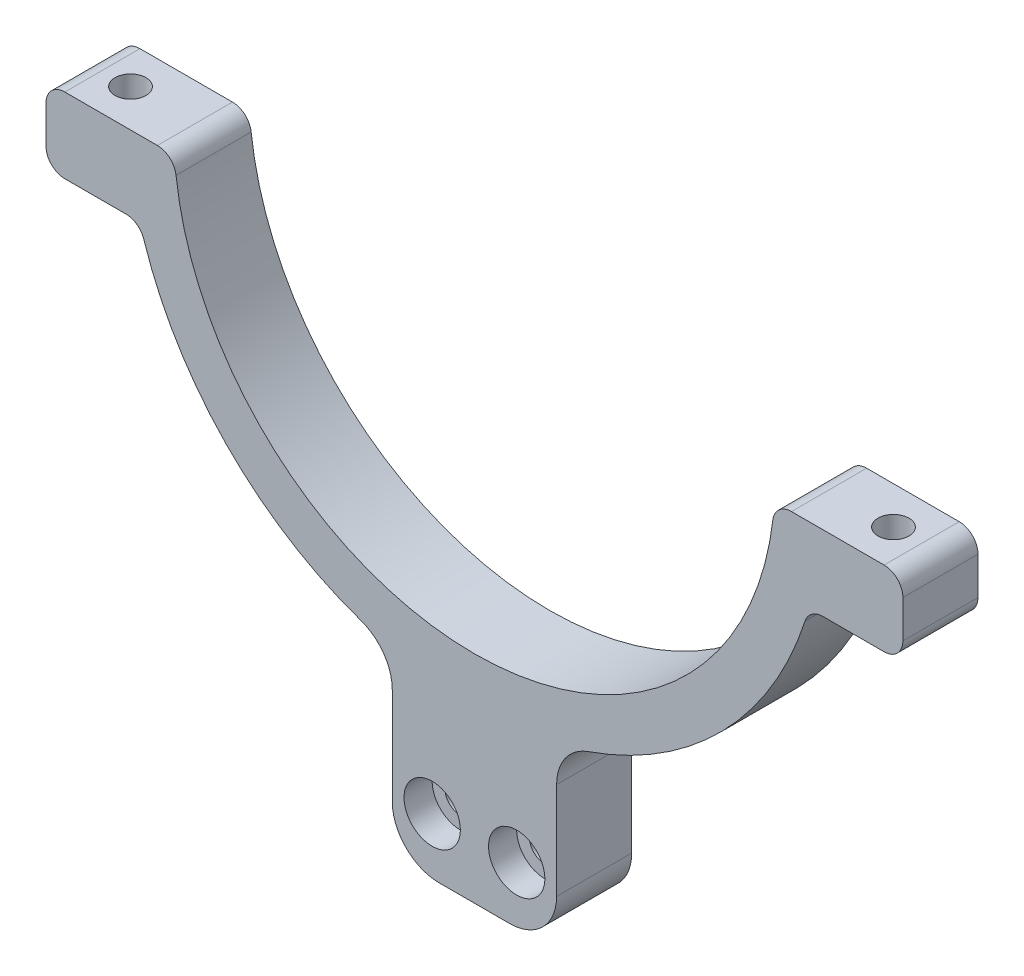
from build123d import *

# Parameters (mm, degrees)
SKETCH3_R           = 8.05
BOSS_EXTRUDE1_DEPTH = 8
SKETCH4_R           = 8.05
SKETCH4_R_2         = 4.3
BOSS_EXTRUDE2_DEPTH = 3
CHAMFER1_SIZE       = 3
FILLET1_R           = 11
SKETCH5_R           = 1.65
CUT_EXTRUDE1_DEPTH  = 85.020655349
SKETCH6_R           = 3
CUT_EXTRUDE2_DEPTH  = 3
SKETCH7_W           = 22
SKETCH7_H           = 25.1
CUT_EXTRUDE3_DEPTH  = 93.528214752
FILLET2_R           = 2
SKETCH8_R           = 1.65
CUT_EXTRUDE4_DEPTH  = 72.905914397
CUT_EXTRUDE5_DEPTH  = 72.905914397
FILLET3_R           = 5
SKETCH10_R          = 3
CUT_EXTRUDE6_DEPTH  = 3


with BuildPart() as part:
    # Sketch3 → Boss-Extrude1 (new body)
    with BuildSketch(Plane.XY):
        with BuildLine():
            Line((-31.937438845, -2), (-45.623026261, -2))
            Line((-45.623026261, -2), (-45.623026261, -10))
            Line((-45.623026261, -10), (-35.623026261, -10))
            ThreePointArc((-35.623026261, -10), (-26.529067588, -25.791637654), (-11, -35.327043465))
            Line((-11, -35.327043465), (-11, -80.1))
            Line((-11, -80.1), (11, -80.1))
            Line((11, -80.1), (11, -35.327043465))
            ThreePointArc((11, -35.327043465), (26.529067588, -25.791637654), (35.623026261, -10))
            Line((35.623026261, -10), (45.623026261, -10))
            Line((45.623026261, -10), (45.623026261, -2))
            Line((45.623026261, -2), (31.937438845, -2))
            ThreePointArc((31.937438845, -2), (0, -32), (-31.937438845, -2))
        make_face()
        with Locations((0, -69.1)):
            Circle(SKETCH3_R, mode=Mode.SUBTRACT)
    extrude(amount=BOSS_EXTRUDE1_DEPTH)

    # Sketch4 → Boss-Extrude2 (add)
    with BuildSketch(Plane.XY):
        with Locations(Location((0, -69.1, 0), (0, 0, 180))):
            Circle(SKETCH4_R)
        with Locations(Location((0, -69.1, 0), (0, 0, 180))):
            Circle(SKETCH4_R_2, mode=Mode.SUBTRACT)
    extrude(amount=BOSS_EXTRUDE2_DEPTH)

    # Chamfer1
    chamfer1_edges = [part.edges().sort_by_distance(p)[0] for p in [
        (0, -80.1, 0),
    ]]
    chamfer(chamfer1_edges, length=CHAMFER1_SIZE)

    # Fillet1
    fillet1_edges = [part.edges().sort_by_distance(p)[0] for p in [
        (-11, -80.1, 5.5),
        (11, -80.1, 5.5),
    ]]
    fillet(fillet1_edges, radius=FILLET1_R - 0.0001)  # a hair under: the kernel refuses the full size

    # Sketch5 → Cut-Extrude1 (cut, through all)
    with BuildSketch(Plane.XZ.offset(10)):
        with Locations((40.623026261, 4)):
            Circle(SKETCH5_R)
    cut_extrude1 = extrude(amount=-CUT_EXTRUDE1_DEPTH, mode=Mode.SUBTRACT)

    # Sketch6 → Cut-Extrude2 (cut)
    with BuildSketch(Plane.XZ.offset(10)):
        with Locations((40.623026261, 4)):
            Circle(SKETCH6_R)
    cut_extrude2 = extrude(amount=-CUT_EXTRUDE2_DEPTH, mode=Mode.SUBTRACT)

    # Mirror1: Cut-Extrude1, Cut-Extrude2 across plane
    add(cut_extrude1.mirror(Plane(origin=(0, 0, 0), x_dir=(0, 0, 1), z_dir=(1, 0, 0))), mode=Mode.SUBTRACT)
    add(cut_extrude2.mirror(Plane(origin=(0, 0, 0), x_dir=(0, 0, 1), z_dir=(1, 0, 0))), mode=Mode.SUBTRACT)

    # Sketch7 → Cut-Extrude3 (cut, through all)
    with BuildSketch(Plane.XY.offset(8)):
        with Locations((0, -67.55)):
            Rectangle(SKETCH7_W, SKETCH7_H)
    extrude(amount=-CUT_EXTRUDE3_DEPTH, mode=Mode.SUBTRACT)

    # Fillet2
    fillet2_edges = [part.edges().sort_by_distance(p)[0] for p in [
        (-45.623026261, -2, 4),
        (-31.937438845, -2, 4),
        (31.937438845, -2, 4),
        (45.623026261, -2, 4),
        (45.623026261, -10, 4),
        (35.623026261, -10, 4),
        (-35.623026261, -10, 4),
        (-45.623026261, -10, 4),
    ]]
    fillet(fillet2_edges, radius=FILLET2_R - 0.0001)  # a hair under: the kernel refuses the full size

    # Sketch8 → Cut-Extrude4 (cut, through all)
    with BuildSketch(Plane.XY.offset(8)):
        with Locations((4.5, -49)):
            Circle(SKETCH8_R)
        with Locations((-4.5, -49)):
            Circle(SKETCH8_R)
    extrude(amount=-CUT_EXTRUDE4_DEPTH, mode=Mode.SUBTRACT)

    # Sketch9 → Cut-Extrude5 (cut, through all)
    with BuildSketch(Plane.XY.offset(8)):
        with BuildLine():
            Line((-8.75, -55), (-8.75, -35.950486784))
            ThreePointArc((-8.75, -35.950486784), (-9.879918795, -35.656517001), (-11, -35.327043465))
            Line((-11, -35.327043465), (-11, -55))
            Line((-11, -55), (-8.75, -55))
        make_face()
        with BuildLine():
            Line((8.75, -55), (8.75, -35.950486784))
            ThreePointArc((8.75, -35.950486784), (9.879918795, -35.656517001), (11, -35.327043465))
            Line((11, -35.327043465), (11, -55))
            Line((11, -55), (8.75, -55))
        make_face()
    extrude(amount=-CUT_EXTRUDE5_DEPTH, mode=Mode.SUBTRACT)

    # Fillet3
    fillet3_edges = [part.edges().sort_by_distance(p)[0] for p in [
        (-8.75, -55, 4),
        (-8.75, -35.950486784, 4),
        (8.75, -55, 4),
        (8.75, -35.950486784, 4),
    ]]
    fillet(fillet3_edges, radius=FILLET3_R)

    # Sketch10 → Cut-Extrude6 (cut)
    with BuildSketch(Plane.XY.offset(8)):
        with Locations((4.5, -49)):
            Circle(SKETCH10_R)
        with Locations((-4.5, -49)):
            Circle(SKETCH10_R)
    extrude(amount=-CUT_EXTRUDE6_DEPTH, mode=Mode.SUBTRACT)


solid = part.part
